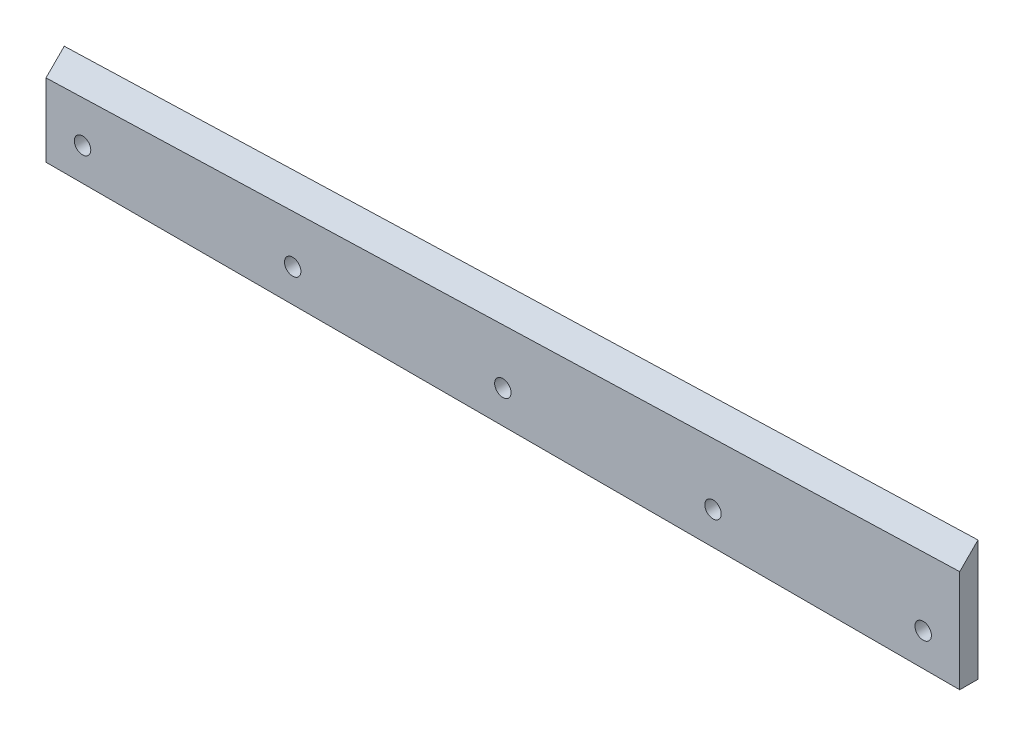
from build123d import *

# Parameters (mm, degrees)
SKETCH1_W            = 5
SKETCH1_H            = 33
BOSS_EXTRUDE1_DEPTH  = 250
CUT_EXTRUDE1_DEPTH   = 253.218159537
CHAMFER1_SIZE        = 5
M4_CLEARANCE_HOLE1_D = 4.5
LPATTERN1_COUNT      = 5
LPATTERN1_PITCH      = 57.5


with BuildPart() as part:
    # Sketch1 → Boss-Extrude1 (new body)
    with BuildSketch(Plane(origin=(0, 0, 0), x_dir=(0, 0, -1), z_dir=(1, 0, 0))):
        with Locations((-2.5, 16.5)):
            Rectangle(SKETCH1_W, SKETCH1_H)
    extrude(amount=BOSS_EXTRUDE1_DEPTH)

    # Sketch2 → Cut-Extrude1 (cut, through all)
    with BuildSketch(Plane.XY):
        Polygon((0, 33), (0, 25), (250, 33), align=None)
    extrude(amount=CUT_EXTRUDE1_DEPTH, mode=Mode.SUBTRACT)

    # Chamfer1
    chamfer1_edges = [part.edges().sort_by_distance(p)[0] for p in [
        (125, 29, 5),
    ]]
    chamfer(chamfer1_edges, length=CHAMFER1_SIZE - 0.0001)  # a hair under: the kernel refuses the full size

    # M4 Clearance Hole1 (through all)
    with Locations(Plane.XY.offset(5)):
        with Locations((240, 9)):
            m4_clearance_hole1 = Hole(M4_CLEARANCE_HOLE1_D / 2)

    # LPattern1: M4 Clearance Hole1 ×5
    with Locations(*[(-i * LPATTERN1_PITCH, 0, 0) for i in range(1, LPATTERN1_COUNT)]):
        add(m4_clearance_hole1, mode=Mode.SUBTRACT)


solid = part.part
